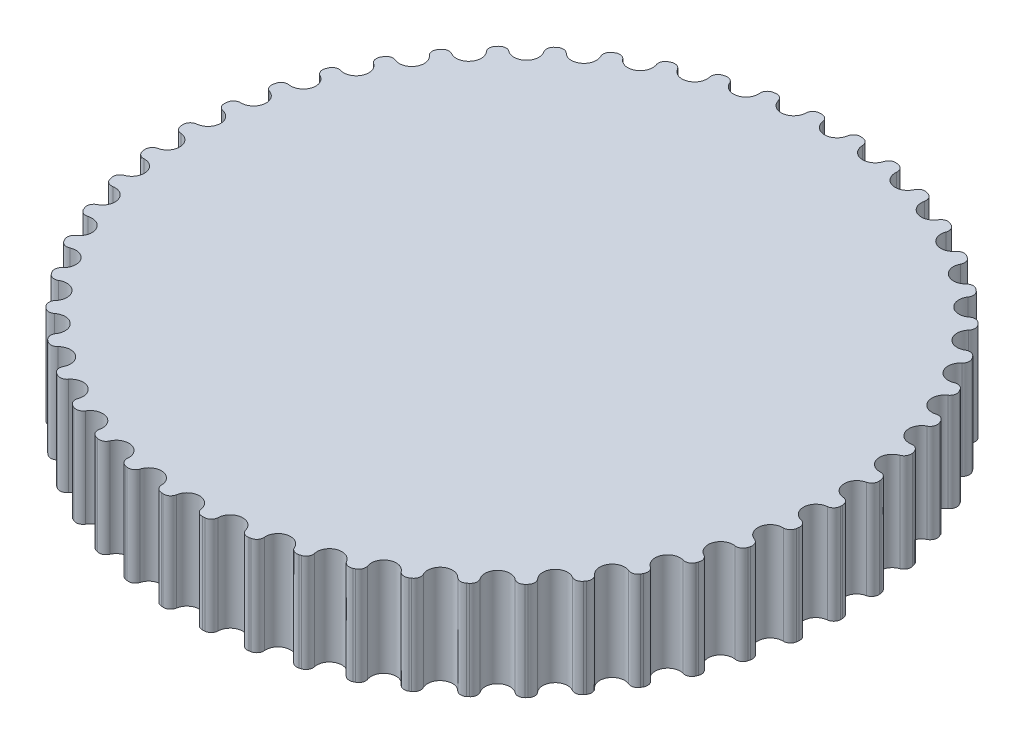
from build123d import *

# Parameters (mm, degrees)
BOSS_EXTRUDE1_DEPTH = 3.499999985
CIRPATTERN1_COUNT   = 50


with BuildPart() as part:
    # Sketch1 → Boss-Extrude1 (new, symmetric)
    with BuildSketch(Plane(origin=(0, 0, 0), x_dir=(1, 0, 0), z_dir=(0, 1, 0))):
        with BuildLine():
            ThreePointArc((0, 22.27212335), (0.579574136, 22.486702133), (0.879677905, 23.026968698))
            ThreePointArc((0.879677905, 23.026968698), (1.059762983, 23.340052161), (1.40375616, 23.450145689))
            ThreePointArc((1.40375616, 23.450145689), (1.475082636, 23.445767111), (1.546395464, 23.441171585))
            ThreePointArc((1.546395464, 23.441171585), (1.873877773, 23.2888324), (2.013303064, 22.955647048))
            ThreePointArc((2.013303064, 22.955647048), (2.24332707, 22.382027671), (2.791437238, 22.096501005))
            ThreePointArc((2.791437238, 22.096501005), (-1.398478196, -22.228174402), (0, 22.27212335))
        make_face()
    boss_extrude1 = extrude(amount=BOSS_EXTRUDE1_DEPTH, both=True)

    # CirPattern1: Boss-Extrude1 ×50 about axis
    cirpattern1_axis = Axis((0, 3.3, 0), (0, -1, 0))
    for i in range(1, CIRPATTERN1_COUNT):
        add(boss_extrude1.rotate(cirpattern1_axis, i * 360 / CIRPATTERN1_COUNT))


solid = part.part
